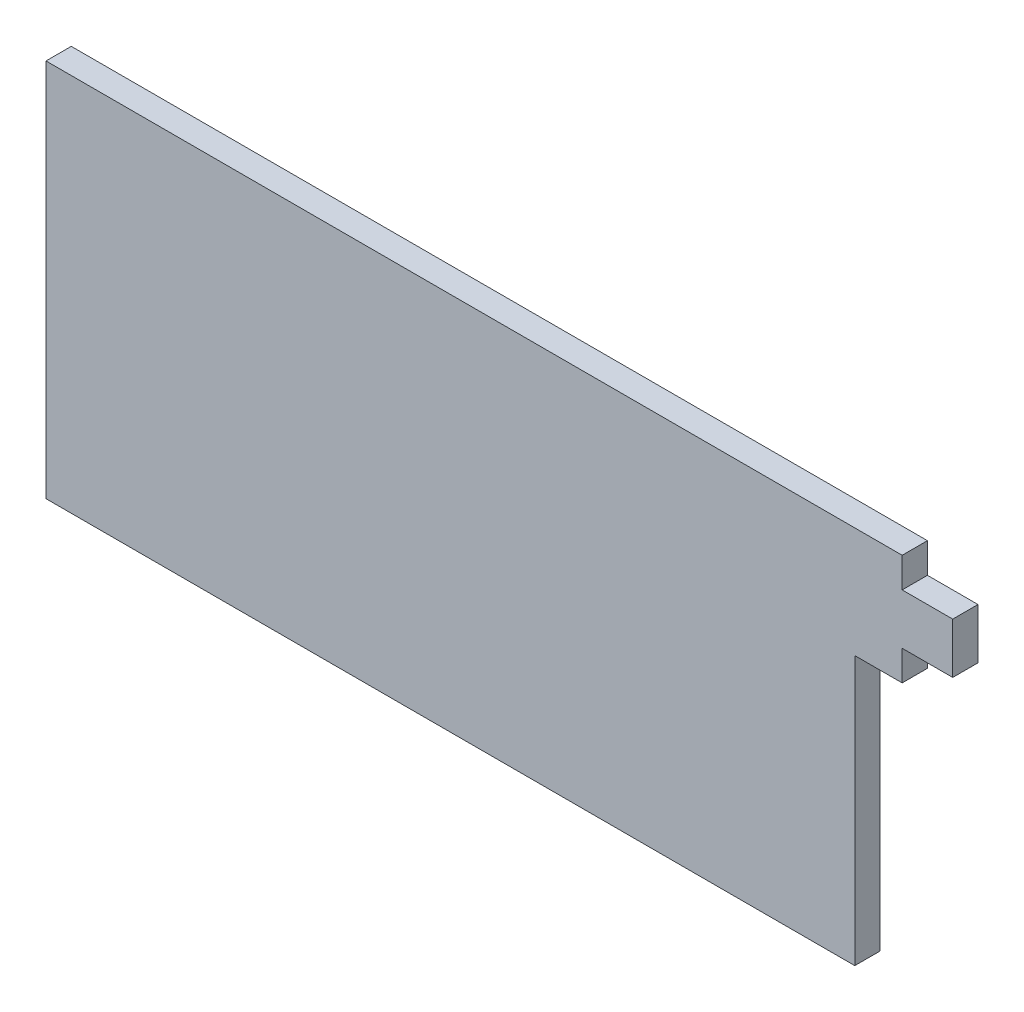
from build123d import *

# Parameters (mm, degrees)
BOSS_EXTRUDE1_DEPTH = 4


with BuildPart() as part:
    # Sketch1 → Boss-Extrude1 (new body)
    with BuildSketch(Plane.XY):
        Polygon((47, 32.200893004), (54.5, 32.200893004), (54.5, 27.450893004), (62.5, 27.450893004), (62.5, 19.450893004), (54.5, 19.450893004), (54.5, 14.700893004), (47, 14.700893004), (47, -27.799106996), (-81, -27.799106996), (-81, 32.200893004), align=None)
    extrude(amount=BOSS_EXTRUDE1_DEPTH)


solid = part.part
